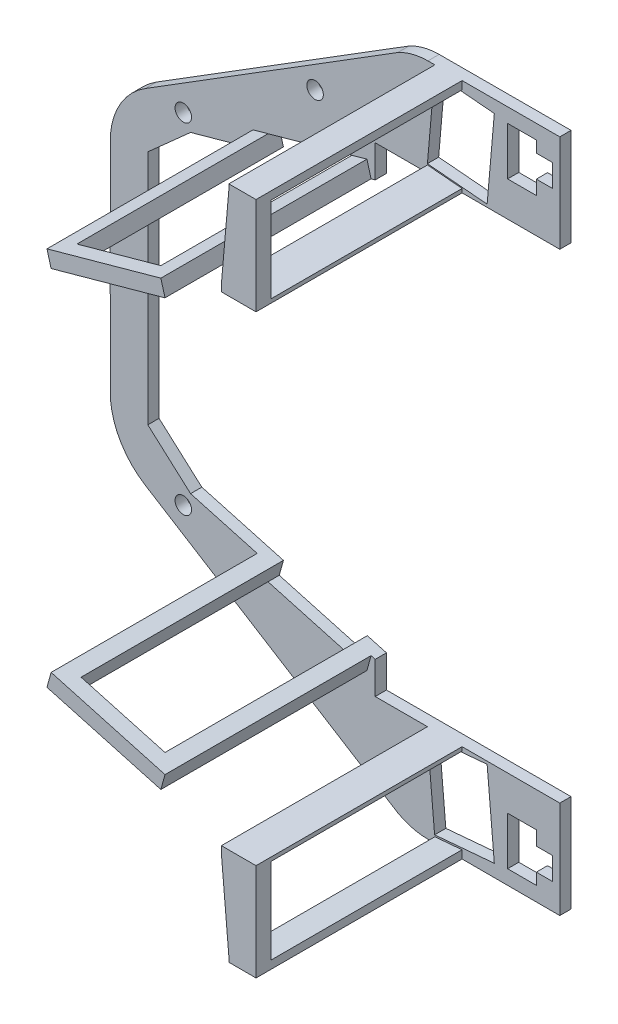
from build123d import *

# Parameters (mm, degrees)
SKETCH1_R           = 1.1
BOSS_EXTRUDE1_DEPTH = 1.5
BOSS_EXTRUDE2_DEPTH = 25.5
BOSS_EXTRUDE4_DEPTH = 2


with BuildPart() as part:
    # Sketch1 → Boss-Extrude1 (new body)
    with BuildSketch(Plane.XY):
        with BuildLine():
            Line((65, 15), (65, 5))
            Line((65, 5), (47.403, 5.0215))
            ThreePointArc((47.403, 5.0215), (45.32489976, 5.287606245), (43.379, 6.064))
            Line((43.379, 6.064), (9.7, 27.063))
            ThreePointArc((9.7, 27.063), (6.483564725, 30.296790106), (5.042, 34.624))
            Line((5.042, 34.624), (5, 50))
            Line((5, 50), (5.042, 65.376))
            ThreePointArc((5.042, 65.376), (6.483564725, 69.703209894), (9.7, 72.937))
            Line((9.7, 72.937), (43.379, 93.936))
            ThreePointArc((43.379, 93.936), (45.32489976, 94.712393755), (47.403, 94.9785))
            Line((47.403, 94.9785), (65, 95))
            Line((65, 95), (65, 85))
            Line((65, 85), (65, 82))
            Line((65, 82), (40.367460006, 82))
            Line((40.367460006, 82), (40.367460006, 77.700799702))
            Line((40.367460006, 77.700799702), (37.816539887, 76.993905452))
            Line((37.816539887, 76.993905452), (37.261948992, 78.995219046))
            Line((37.261948992, 78.995219046), (26.063497318, 75.891977576))
            Line((26.063497318, 75.891977576), (26.618088213, 73.890663982))
            Line((26.618088213, 73.890663982), (15.728591185, 70.873037998))
            Line((15.728591185, 70.873037998), (10.021, 65.77301003))
            Line((10.021, 65.77301003), (10.021, 34.22698997))
            Line((10.021, 34.22698997), (15.728591185, 29.126962002))
            Line((15.728591185, 29.126962002), (26.618088213, 26.109336018))
            Line((26.618088213, 26.109336018), (26.063497318, 24.108022424))
            Line((26.063497318, 24.108022424), (37.261948992, 21.004780954))
            Line((37.261948992, 21.004780954), (37.816539887, 23.006094548))
            Line((37.816539887, 23.006094548), (40.367460006, 22.299200298))
            Line((40.367460006, 22.299200298), (40.367460006, 18))
            Line((40.367460006, 18), (65, 18))
            Line((65, 18), (65, 15))
        make_face()
        with Locations((32.343, 84.089)):
            Circle(SKETCH1_R, mode=Mode.SUBTRACT)
        with Locations((14.76, 72.68)):
            Circle(SKETCH1_R, mode=Mode.SUBTRACT)
        with Locations((14.76, 27.32)):
            Circle(SKETCH1_R, mode=Mode.SUBTRACT)
        with Locations((32.343, 15.911)):
            Circle(SKETCH1_R, mode=Mode.SUBTRACT)
        Polygon((47.33363322, 83.065556795), (55.303190804, 82.368310853), (56.261903975, 93.326452532), (48.29234639, 94.023698474), align=None, mode=Mode.SUBTRACT)
        Polygon((58.032899046, 86.65175686), (61.864724228, 86.65175686), (61.864724228, 88.544627634), (64.004574654, 88.544627634), (64.004574654, 91.546423221), (61.864868117, 91.546423221), (61.864868117, 93.072013731), (58.032899046, 93.072013731), align=None, mode=Mode.SUBTRACT)
        Polygon((56.261903975, 6.673547468), (48.29234639, 5.976301526), (47.33363322, 16.934443205), (55.303190804, 17.631689147), align=None, mode=Mode.SUBTRACT)
        Polygon((58.032899046, 13.34824314), (61.864724228, 13.34824314), (61.864724228, 11.455372366), (64.004574654, 11.455372366), (64.004574654, 8.453576779), (61.864868117, 8.453576779), (61.864868117, 6.927986269), (58.032899046, 6.927986269), align=None, mode=Mode.SUBTRACT)
    extrude(amount=BOSS_EXTRUDE1_DEPTH)

    # Sketch2 → Boss-Extrude2 (add)
    with BuildSketch(Plane.XY.offset(1.5)):
        Polygon((26.618088213, 26.109336018), (26.063497318, 24.108022424), (24.063497318, 24.662249304), (24.618088213, 26.663562898), align=None)
        Polygon((37.261948992, 21.004780954), (37.816539887, 23.006094548), (39.816539887, 22.451867667), (39.261948992, 20.450554074), align=None)
        Polygon((39.816539887, 77.548132333), (39.261948992, 79.549445926), (37.261948992, 78.995219046), (37.816539887, 76.993905452), align=None)
        Polygon((26.063497318, 75.891977576), (24.063497318, 75.337750696), (24.618088213, 73.336437102), (26.618088213, 73.890663982), align=None)
        Polygon((47.340340229, 18), (51.96241715, 18), (51.96241715, 17.488205474), (47.340340229, 17.083826141), align=None)
        Polygon((48.330167759, 5.770045696), (51.96241715, 6.087826341), (51.96241715, 5.015929308), (48.330167759, 5.020367187), (48.330167759, 5.551877825), align=None)
        Polygon((48.330167759, 94.979632813), (48.330167759, 94.448122175), (48.330167759, 94.229954304), (51.96241715, 93.912173659), (51.96241715, 94.984070692), align=None)
        Polygon((47.340340229, 82.916173859), (51.96241715, 82.511794526), (51.96241715, 82), (47.340340229, 82), align=None)
    extrude(amount=BOSS_EXTRUDE2_DEPTH)

    # Sketch4 → Boss-Extrude4 (add)
    with BuildSketch(Plane.XY.offset(27)):
        Polygon((48.330167759, 5.020367187), (48.330167759, 5.770045696), (47.340340229, 17.083826141), (47.340340229, 18), (51.96241715, 18), (51.96241715, 17.488205474), (51.96241715, 5.015929308), align=None)
        Polygon((24.618088213, 26.663562898), (39.816539887, 22.451867667), (39.261948992, 20.450554074), (24.063497318, 24.662249304), align=None)
        Polygon((51.96241715, 82.511794526), (51.96241715, 94.984070692), (48.330167759, 94.979632813), (48.330167759, 94.229954304), (47.340340229, 82.916173859), (47.340340229, 82), (51.96241715, 82), align=None)
        Polygon((39.261948992, 79.549445926), (24.063497318, 75.337750696), (24.618088213, 73.336437102), (39.816539887, 77.548132333), align=None)
    extrude(amount=BOSS_EXTRUDE4_DEPTH)


solid = part.part
